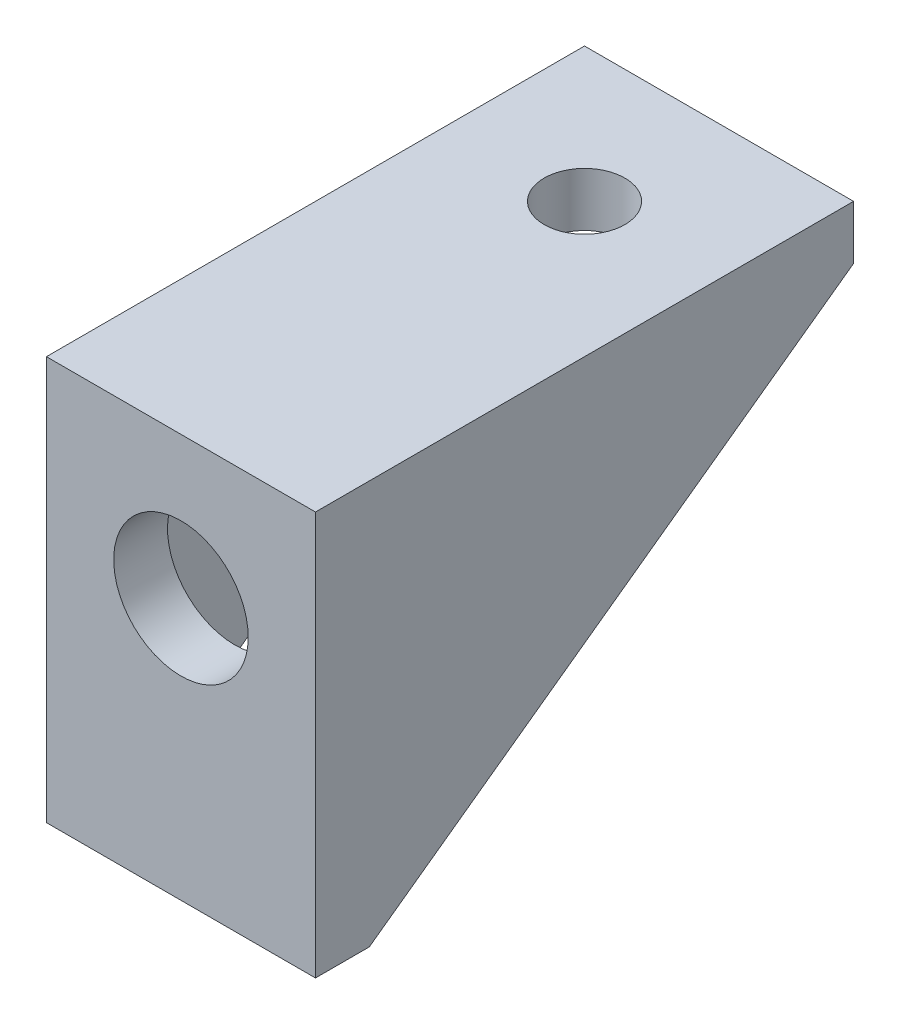
from build123d import *

# Parameters (mm, degrees)
BOSS_EXTRUDE1_DEPTH = 10
CUT_EXTRUDE1_REACH  = 28.926
SKETCH2_R           = 2.5
CUT_EXTRUDE2_REACH  = 28.926
SKETCH3_R           = 1.5
BOSS_EXTRUDE2_DEPTH = 1


with BuildPart() as part:
    # Sketch1 → Boss-Extrude1 (new body)
    with BuildSketch(Plane(origin=(0, 0, 0), x_dir=(0, 0, -1), z_dir=(1, 0, 0))):
        Polygon((0, 0), (20, 0), (20, -2), (2, -2), (2, -15), (0, -15), align=None)
    extrude(amount=BOSS_EXTRUDE1_DEPTH)

    # Sketch2 → Cut-Extrude1 (cut, up to next)
    with BuildSketch(Plane.XY, mode=Mode.PRIVATE) as cut_extrude1_sk1:
        with Locations((5, -5.28)):
            Circle(SKETCH2_R)
    cut_extrude1_tool1 = extrude(cut_extrude1_sk1.sketch, amount=-CUT_EXTRUDE1_REACH, mode=Mode.PRIVATE) & part.part
    add(cut_extrude1_tool1.solids().sort_by_distance((5, -5.28, 0))[0], mode=Mode.SUBTRACT)

    # Sketch3 → Cut-Extrude2 (cut, up to next)
    with BuildSketch(Plane(origin=(0, 0, 0), x_dir=(1, 0, 0), z_dir=(0, 1, 0)), mode=Mode.PRIVATE) as cut_extrude2_sk1:
        with Locations((5, 15)):
            Circle(SKETCH3_R)
    cut_extrude2_tool1 = extrude(cut_extrude2_sk1.sketch, amount=-CUT_EXTRUDE2_REACH, mode=Mode.PRIVATE) & part.part
    add(cut_extrude2_tool1.solids().sort_by_distance((5, 0, -15))[0], mode=Mode.SUBTRACT)

    # Sketch5 → Boss-Extrude2 (add)
    with BuildSketch(Plane(origin=(10, 0, 0), x_dir=(0, 0, -1), z_dir=(1, 0, 0))):
        Polygon((20, -2), (2, -15), (2, -2), align=None)
    boss_extrude2 = extrude(amount=-BOSS_EXTRUDE2_DEPTH)

    # Mirror1: Boss-Extrude2 across plane
    add(boss_extrude2.mirror(Plane.ZY.offset(-5)))


solid = part.part
